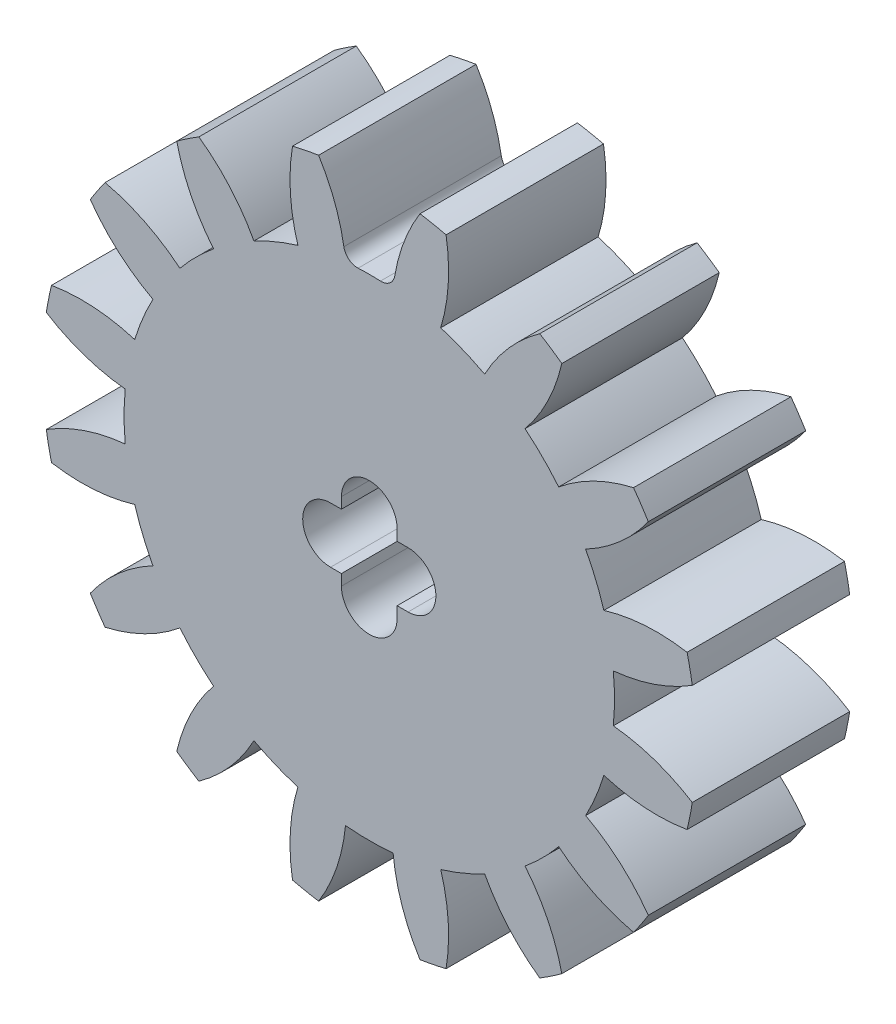
from build123d import *

# Parameters (mm, degrees)
SKETCH1_R           = 13.5
BOSS_EXTRUDE1_DEPTH = 3.25
CUT_EXTRUDE1_DEPTH  = 20.366530407
FILLET1_R           = 0.57
CIRPATTERN3_COUNT   = 16


with BuildPart() as part:
    # Sketch1 → Boss-Extrude1 (new, symmetric)
    with BuildSketch(Plane.XY):
        Circle(SKETCH1_R)
        with BuildLine():
            ThreePointArc((1.15, -1.6), (0, -2.75), (-1.15, -1.6))
            Line((-1.15, -1.6), (-1.15, -1.15))
            Line((-1.15, -1.15), (-1.6, -1.15))
            ThreePointArc((-1.6, -1.15), (-2.75, 0), (-1.6, 1.15))
            Line((-1.6, 1.15), (-1.15, 1.15))
            Line((-1.15, 1.15), (-1.15, 1.6))
            ThreePointArc((-1.15, 1.6), (0, 2.75), (1.15, 1.6))
            Line((1.15, 1.6), (1.15, 1.15))
            Line((1.15, 1.15), (1.6, 1.15))
            ThreePointArc((1.6, 1.15), (2.75, 0), (1.6, -1.15))
            Line((1.6, -1.15), (1.15, -1.15))
            Line((1.15, -1.15), (1.15, -1.6))
        make_face(mode=Mode.SUBTRACT)
    extrude(amount=BOSS_EXTRUDE1_DEPTH, both=True)

    # Sketch2 → Cut-Extrude1 (cut, symmetric)
    with BuildSketch(Plane.XY):
        with BuildLine():
            ThreePointArc((0.982234387, 10.077243701), (0, 10.125), (-0.982234387, 10.077243701))
            ThreePointArc((-0.982234387, 10.077243701), (-1.348268622, 11.771504161), (-2.092826994, 13.336794037))
            ThreePointArc((-2.092826994, 13.336794037), (0, 13.5), (2.092826994, 13.336794037))
            ThreePointArc((2.092826994, 13.336794037), (1.348268622, 11.771504161), (0.982234387, 10.077243701))
        make_face()
    cut_extrude1 = extrude(amount=CUT_EXTRUDE1_DEPTH, both=True, mode=Mode.SUBTRACT)

    # Fillet1
    fillet1_edges = [part.edges().sort_by_distance(p)[0] for p in [
        (0.982234387, 10.077243701, 0),
        (-0.982234387, 10.077243701, 0),
    ]]
    fillet(fillet1_edges, radius=FILLET1_R)

    # CirPattern3: Cut-Extrude1 ×16 about axis
    cirpattern3_axis = Axis((0, 0, 3.25), (0, 0, -1))
    for i in range(1, CIRPATTERN3_COUNT):
        add(cut_extrude1.rotate(cirpattern3_axis, i * 360 / CIRPATTERN3_COUNT), mode=Mode.SUBTRACT)


solid = part.part
